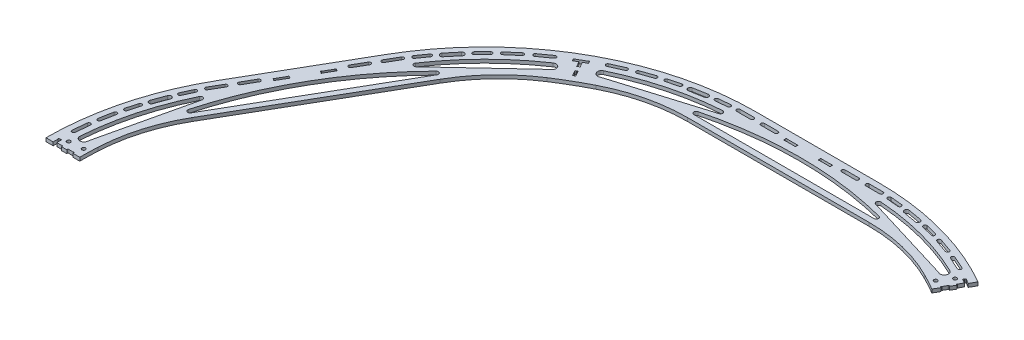
from build123d import *

# Parameters (mm, degrees)
SKETCH_1_R                       = 327.5
SKETCH_1_R_2                     = 312.5
EXTRUDE_1_DEPTH                  = 3
FILLET_1_R                       = 235
CUT_EXTRUDE_5_DEPTH              = 474.39115881
CUT_EXTRUDE_6_DEPTH              = 3
PATTERN_CIRCULAR_1_COUNT         = 5
PATTERN_CIRCULAR_1_ANGLE         = 240
PATTERN_CIRCULAR_5_COUNT         = 6
SKETCH_3_W                       = 214.60661686
SKETCH_3_H                       = 5
EXTRUDE_1_2_DEPTH                = 3
FILLET_2_R                       = 2
FILLET_3_R                       = 140
PATTERN_CIRCULAR_3_COUNT         = 6
FILLET_2_OF_PATTERN_CIRCULAR_3_R = 2
FILLET_3_OF_PATTERN_CIRCULAR_3_R = 140
CUT_EXTRUDE_8_DEPTH              = 10
FILLET_4_R                       = 3.5
FILLET_5_R                       = 2
FILLET_4_OF_MIRROR_2_R           = 3.5
FILLET_5_OF_MIRROR_2_R           = 2
PATTERN_CIRCULAR_6_COUNT         = 5
PATTERN_CIRCULAR_6_ANGLE         = 240
FILLET_4_OF_PATTERN_CIRCULAR_6_R = 3.5
FILLET_5_OF_PATTERN_CIRCULAR_6_R = 2
PATTERN_CIRCULAR_7_DEPTH         = 3
FILLET_6_R                       = 150
CUT_EXTRUDE_9_DEPTH              = 10
EXTRUDE_2_DEPTH                  = 3
FILLET_7_R                       = 2
FILLET_8_R                       = 1
FILLET_9_R                       = 3
FILLET_10_R                      = 1
FILLET_11_R                      = 10
SKETCH_14_R                      = 1.55
CUT_EXTRUDE_12_DEPTH             = 474.391158952
PATTERN_CIRCULAR_8_COUNT         = 3
CUT_EXTRUDE_11_DEPTH             = 474.391158952


with BuildPart() as part:
    # 草图1 → Extrude 1 (new body)
    # profile 1 of 7: a face of its own
    with BuildSketch(Plane(origin=(0, 0, 0), x_dir=(1, 0, 0), z_dir=(0, 1, 0))):
        with BuildLine():
            Line((283.623316881, 163.75000495), (189.08221316, 327.5))
            Line((189.08221316, 327.5), (3.91e-07, 327.5))
            ThreePointArc((3.91e-07, 327.5), (163.749997694, 283.623321071), (283.623316881, 163.75000495))
        make_face()
    # profile 2 of 7: a face of its own
    with BuildSketch(Plane(origin=(0, 0, 0), x_dir=(1, 0, 0), z_dir=(0, 1, 0))):
        Circle(SKETCH_1_R)
        with Locations(Location((0, 0, 0), (0, 0, 270))):
            Circle(SKETCH_1_R_2, mode=Mode.SUBTRACT)
    # profile 3 of 7: a face of its own
    with BuildSketch(Plane(origin=(0, 0, 0), x_dir=(1, 0, 0), z_dir=(0, 1, 0))):
        with BuildLine():
            Line((378.164426319, 0), (283.623316881, 163.75000495))
            ThreePointArc((283.623316881, 163.75000495), (316.34070737, 84.763240032), (327.5, 0))
            ThreePointArc((327.5, 0), (316.340709033, -84.763233826), (283.623323306, -163.749993823))
            Line((283.623323306, -163.749993823), (378.164426319, 0))
        make_face()
    # profile 4 of 7: a face of its own
    with BuildSketch(Plane(origin=(0, 0, 0), x_dir=(1, 0, 0), z_dir=(0, 1, 0))):
        with BuildLine():
            Line((189.08221316, -327.5), (283.623323306, -163.749993823))
            ThreePointArc((283.623323306, -163.749993823), (163.750003363, -283.623317798), (6.33e-07, -327.5))
            Line((6.33e-07, -327.5), (189.08221316, -327.5))
        make_face()
    # profile 5 of 7: a face of its own
    with BuildSketch(Plane(origin=(0, 0, 0), x_dir=(1, 0, 0), z_dir=(0, 1, 0))):
        with BuildLine():
            ThreePointArc((6.33e-07, -327.5), (-163.749996617, -283.623321693), (-283.62331615, -163.750006218))
            Line((-283.62331615, -163.750006218), (-189.08221316, -327.5))
            Line((-189.08221316, -327.5), (6.33e-07, -327.5))
        make_face()
    # profile 6 of 7: a face of its own
    with BuildSketch(Plane(origin=(0, 0, 0), x_dir=(1, 0, 0), z_dir=(0, 1, 0))):
        with BuildLine():
            ThreePointArc((-283.62331615, -163.750006218), (-327.5, 2.592e-06), (-283.623313558, 163.750010707))
            Line((-283.623313558, 163.750010707), (-378.164426319, 0))
            Line((-378.164426319, 0), (-283.62331615, -163.750006218))
        make_face()
    # profile 7 of 7: a face of its own
    with BuildSketch(Plane(origin=(0, 0, 0), x_dir=(1, 0, 0), z_dir=(0, 1, 0))):
        with BuildLine():
            ThreePointArc((-283.623313558, 163.750010707), (-163.749994477, 283.623322928), (3.91e-07, 327.5))
            Line((3.91e-07, 327.5), (-189.08221316, 327.5))
            Line((-189.08221316, 327.5), (-283.623313558, 163.750010707))
        make_face()
    extrude(amount=EXTRUDE_1_DEPTH)

    # 圆角1
    fillet_1_edges = [part.edges().sort_by_distance(p)[0] for p in [
        (189.08221316, 1.5, -327.5),
        (378.164426319, 1.5, 0),
        (189.08221316, 1.5, 327.5),
        (-189.08221316, 1.5, 327.5),
        (-378.164426319, 1.5, 0),
        (-189.08221316, 1.5, -327.5),
    ]]
    fillet(fillet_1_edges, radius=FILLET_1_R)

    # 草图2 → 切除-拉伸5 (cut, through all)
    with BuildSketch(Plane(origin=(0, 3, 0), x_dir=(1, 0, 0), z_dir=(0, 1, 0))):
        with BuildLine():
            ThreePointArc((162.730125101, 291.956844598), (162.426521922, 291.723881685), (162.376571711, 291.344472162))
            ThreePointArc((162.376571711, 291.344472162), (162.609534624, 291.040868983), (162.988944147, 290.990918772))
            Line((162.988944147, 290.990918772), (165.840673326, 289.344472162))
            Line((165.840673326, 289.344472162), (163.644226717, 285.540115039))
            ThreePointArc((163.644226717, 285.540115039), (163.290673326, 284.927742603), (163.903045762, 284.574189212))
            Line((163.903045762, 284.574189212), (164.496954238, 284.231295993))
            ThreePointArc((164.496954238, 284.231295993), (165.109326674, 283.877742603), (165.462880065, 284.490115039))
            Line((165.462880065, 284.490115039), (167.659326674, 288.294472162))
            Line((167.659326674, 288.294472162), (170.511055853, 286.648025553))
            ThreePointArc((170.511055853, 286.648025553), (170.744018767, 286.344422373), (171.123428289, 286.294472162))
            ThreePointArc((171.123428289, 286.294472162), (171.427031468, 286.527435075), (171.47698168, 286.906844598))
            Line((171.47698168, 286.906844598), (171.819874899, 287.500753074))
            ThreePointArc((171.819874899, 287.500753074), (172.123478078, 287.733715988), (172.173428289, 288.11312551))
            ThreePointArc((172.173428289, 288.11312551), (171.940465376, 288.416728689), (171.561055853, 288.466678901))
            Line((171.561055853, 288.466678901), (164.038944147, 292.809572119))
            ThreePointArc((164.038944147, 292.809572119), (163.426571711, 293.16312551), (163.07301832, 292.550753074))
            Line((163.07301832, 292.550753074), (162.730125101, 291.956844598))
        make_face()
        with BuildLine():
            Line((162.096954238, 280.074374055), (161.503045762, 280.417267274))
            ThreePointArc((161.503045762, 280.417267274), (160.890673326, 280.770820665), (160.537119935, 280.158448229))
            Line((160.537119935, 280.158448229), (158.644226717, 276.879861001))
            ThreePointArc((158.644226717, 276.879861001), (158.290673326, 276.267488565), (158.903045762, 275.913935174))
            Line((158.903045762, 275.913935174), (159.496954238, 275.571041956))
            ThreePointArc((159.496954238, 275.571041956), (160.109326674, 275.217488565), (160.462880065, 275.829861001))
            Line((160.462880065, 275.829861001), (162.355773283, 279.108448229))
            ThreePointArc((162.355773283, 279.108448229), (162.709326674, 279.720820665), (162.096954238, 280.074374055))
        make_face()
    cut_extrude_5 = extrude(amount=-CUT_EXTRUDE_5_DEPTH, mode=Mode.SUBTRACT)

    # 草图2<4> → 切除-拉伸6 (cut)
    with BuildSketch(Plane(origin=(0, 3, 0), x_dir=(1, 0, 0), z_dir=(0, 1, 0))):
        Polygon((10.657106781, 320.55), (9.95, 320.55), (9.95, 319.842893219), (9.95, 319.157106781), (9.95, 318.45), (10.657106781, 318.45), (19.342893219, 318.45), (20.05, 318.45), (20.05, 319.157106781), (20.05, 319.842893219), (20.05, 320.55), (19.342893219, 320.55), align=None)
        with BuildLine():
            ThreePointArc((20.05, 320.55), (19.696446609, 320.696446609), (19.342893219, 320.55))
            Line((19.342893219, 320.55), (20.05, 320.55))
        make_face()
        with BuildLine():
            ThreePointArc((20.05, 319.842893219), (20.196446609, 320.196446609), (20.05, 320.55))
            Line((20.05, 320.55), (20.05, 319.842893219))
        make_face()
        with BuildLine():
            Line((20.05, 319.157106781), (20.05, 318.45))
            ThreePointArc((20.05, 318.45), (20.196446609, 318.803553391), (20.05, 319.157106781))
        make_face()
        with BuildLine():
            Line((20.05, 318.45), (19.342893219, 318.45))
            ThreePointArc((19.342893219, 318.45), (19.696446609, 318.303553391), (20.05, 318.45))
        make_face()
        with BuildLine():
            ThreePointArc((9.95, 319.157106781), (9.803553391, 318.803553391), (9.95, 318.45))
            Line((9.95, 318.45), (9.95, 319.157106781))
        make_face()
        with BuildLine():
            Line((10.657106781, 318.45), (9.95, 318.45))
            ThreePointArc((9.95, 318.45), (10.303553391, 318.303553391), (10.657106781, 318.45))
        make_face()
        with BuildLine():
            Line((9.95, 319.842893219), (9.95, 320.55))
            ThreePointArc((9.95, 320.55), (9.803553391, 320.196446609), (9.95, 319.842893219))
        make_face()
        with BuildLine():
            ThreePointArc((10.657106781, 320.55), (10.303553391, 320.696446609), (9.95, 320.55))
            Line((9.95, 320.55), (10.657106781, 320.55))
        make_face()
        Polygon((-19.342893219, 320.55), (-20.05, 320.55), (-20.05, 319.842893219), (-20.05, 319.157106781), (-20.05, 318.45), (-19.342893219, 318.45), (-10.657106781, 318.45), (-9.95, 318.45), (-9.95, 319.157106781), (-9.95, 319.842893219), (-9.95, 320.55), (-10.657106781, 320.55), align=None)
        with BuildLine():
            Line((-20.05, 319.842893219), (-20.05, 320.55))
            ThreePointArc((-20.05, 320.55), (-20.196446609, 320.196446609), (-20.05, 319.842893219))
        make_face()
        with BuildLine():
            ThreePointArc((-19.342893219, 320.55), (-19.696446609, 320.696446609), (-20.05, 320.55))
            Line((-20.05, 320.55), (-19.342893219, 320.55))
        make_face()
        with BuildLine():
            Line((-20.05, 318.45), (-20.05, 319.157106781))
            ThreePointArc((-20.05, 319.157106781), (-20.196446609, 318.803553391), (-20.05, 318.45))
        make_face()
        with BuildLine():
            Line((-19.342893219, 318.45), (-20.05, 318.45))
            ThreePointArc((-20.05, 318.45), (-19.696446609, 318.303553391), (-19.342893219, 318.45))
        make_face()
        with BuildLine():
            ThreePointArc((-9.95, 319.842893219), (-9.803553391, 320.196446609), (-9.95, 320.55))
            Line((-9.95, 320.55), (-9.95, 319.842893219))
        make_face()
        with BuildLine():
            ThreePointArc((-9.95, 320.55), (-10.303553391, 320.696446609), (-10.657106781, 320.55))
            Line((-10.657106781, 320.55), (-9.95, 320.55))
        make_face()
        with BuildLine():
            ThreePointArc((-9.95, 318.45), (-9.803553391, 318.803553391), (-9.95, 319.157106781))
            Line((-9.95, 319.157106781), (-9.95, 318.45))
        make_face()
        with BuildLine():
            Line((-9.95, 318.45), (-10.657106781, 318.45))
            ThreePointArc((-10.657106781, 318.45), (-10.303553391, 318.303553391), (-9.95, 318.45))
        make_face()
    cut_extrude_6 = extrude(amount=-CUT_EXTRUDE_6_DEPTH, mode=Mode.SUBTRACT)

    # 阵列(圆周)1: 切除-拉伸5 ×5 about axis
    pattern_circular_1_axis = Axis((0, 0, 0), (0, 1, 0))
    for i in range(1, PATTERN_CIRCULAR_1_COUNT):
        add(cut_extrude_5.rotate(pattern_circular_1_axis, i * PATTERN_CIRCULAR_1_ANGLE / (PATTERN_CIRCULAR_1_COUNT - 1)), mode=Mode.SUBTRACT)

    # 阵列(圆周)5: 切除-拉伸6 ×6 about axis
    pattern_circular_5_axis = Axis((0, 0, 0), (0, 1, 0))
    for i in range(1, PATTERN_CIRCULAR_5_COUNT):
        add(cut_extrude_6.rotate(pattern_circular_5_axis, i * 360 / PATTERN_CIRCULAR_5_COUNT), mode=Mode.SUBTRACT)

    # 草图3 → Extrude 1 2 (add)
    with BuildSketch(Plane(origin=(0, 3, 0), x_dir=(1, 0, 0), z_dir=(0, 1, 0))):
        with Locations((0, 296)):
            Rectangle(SKETCH_3_W, SKETCH_3_H)
    extrude_1_2 = extrude(amount=-EXTRUDE_1_2_DEPTH)

    # 圆角2
    fillet_2_edges = [part.edges().sort_by_distance(p)[0] for p in [
        (-92.487837038, 1.5, -298.5),
        (92.487837038, 1.5, -298.5),
    ]]
    fillet(fillet_2_edges, radius=FILLET_2_R)

    # 圆角3
    fillet_3_edges = [part.edges().sort_by_distance(p)[0] for p in [
        (-107.30330843, 1.5, -293.5),
        (107.30330843, 1.5, -293.5),
    ]]
    fillet(fillet_3_edges, radius=FILLET_3_R)

    # 阵列(圆周)3: Extrude 1 2 ×6 about axis
    pattern_circular_3_axis = Axis((0, 0, 0), (0, 1, 0))
    for i in range(1, PATTERN_CIRCULAR_3_COUNT):
        add(extrude_1_2.rotate(pattern_circular_3_axis, i * 360 / PATTERN_CIRCULAR_3_COUNT))

    # 圆角2 of 阵列(圆周)3
    fillet_2_of_pattern_circular_3_edges = [part.edges().sort_by_distance(p)[0] for p in [
        (-304.752501549, 1.5, -69.153183584),
        (-212.264664511, 1.5, -229.346816416),
        (-212.264664511, 1.5, 229.346816416),
        (-304.752501549, 1.5, 69.153183584),
        (92.487837038, 1.5, 298.5),
        (-92.487837038, 1.5, 298.5),
        (304.752501549, 1.5, 69.153183584),
        (212.264664511, 1.5, 229.346816416),
        (212.264664511, 1.5, -229.346816416),
        (304.752501549, 1.5, -69.153183584),
    ]]
    fillet(fillet_2_of_pattern_circular_3_edges, radius=FILLET_2_OF_PATTERN_CIRCULAR_3_R)

    # 圆角3 of 阵列(圆周)3
    fillet_3_of_pattern_circular_3_edges = [part.edges().sort_by_distance(p)[0] for p in [
        (-307.830110226, 1.5, -53.82260899),
        (-200.526801796, 1.5, -239.67739101),
        (-200.526801796, 1.5, 239.67739101),
        (-307.830110226, 1.5, 53.82260899),
        (107.30330843, 1.5, 293.5),
        (-107.30330843, 1.5, 293.5),
        (307.830110226, 1.5, 53.82260899),
        (200.526801796, 1.5, 239.67739101),
        (200.526801796, 1.5, -239.67739101),
        (307.830110226, 1.5, -53.82260899),
    ]]
    fillet(fillet_3_of_pattern_circular_3_edges, radius=FILLET_3_OF_PATTERN_CIRCULAR_3_R)

    # 草图7 → 切除-拉伸8 (cut)
    with BuildSketch(Plane.XZ):
        with BuildLine():
            Line((175.029626383, 278.218674096), (171.086610158, 272.197762343))
            ThreePointArc((171.086610158, 272.197762343), (172.755924627, 271.141366276), (174.418716459, 270.074732896))
            Line((174.418716459, 270.074732896), (245.66253954, 203.5))
            ThreePointArc((245.66253954, 203.5), (214.731447639, 245.004901543), (175.029626383, 278.218674096))
        make_face()
        with BuildLine():
            Line((264.76819272, 186.40803798), (258.76819272, 196.800342825))
            ThreePointArc((258.76819272, 196.800342825), (256.719154615, 197.349380931), (256.170116509, 195.300342825))
            Line((256.170116509, 195.300342825), (262.170116509, 184.90803798))
            ThreePointArc((262.170116509, 184.90803798), (264.219154615, 184.358999874), (264.76819272, 186.40803798))
        make_face()
        with BuildLine():
            ThreePointArc((190.839721204, 273.168590348), (192.933431066, 273.509734029), (192.592287386, 275.603443891))
            Line((192.592287386, 275.603443891), (182.852873213, 282.61370862))
            ThreePointArc((182.852873213, 282.61370862), (180.75916335, 282.27256494), (181.10030703, 280.178855077))
            Line((181.10030703, 280.178855077), (190.839721204, 273.168590348))
        make_face()
        with BuildLine():
            ThreePointArc((206.108151691, 260.461860366), (208.223669166, 260.618659005), (208.066870527, 262.73417648))
            Line((208.066870527, 262.73417648), (198.977606072, 270.569051825))
            ThreePointArc((198.977606072, 270.569051825), (196.862088597, 270.412253186), (197.018887236, 268.296735711))
            Line((197.018887236, 268.296735711), (206.108151691, 260.461860366))
        make_face()
        with BuildLine():
            ThreePointArc((218.524851069, 248.271396128), (220.646117994, 248.256341871), (220.661172251, 250.377608797))
            Line((220.661172251, 250.377608797), (213.640463353, 257.498679403))
            ThreePointArc((213.640463353, 257.498679403), (211.519196428, 257.51373366), (211.504142171, 255.392466734))
            Line((211.504142171, 255.392466734), (218.524851069, 248.271396128))
        make_face()
        with BuildLine():
            ThreePointArc((230.453086683, 232.965532251), (233.270529754, 232.716505069), (233.519556936, 235.533948141))
            Line((233.519556936, 235.533948141), (225.814309265, 244.733358901))
            ThreePointArc((225.814309265, 244.733358901), (222.996866194, 244.982386083), (222.747839012, 242.164943011))
            Line((222.747839012, 242.164943011), (230.453086683, 232.965532251))
        make_face()
        with BuildLine():
            ThreePointArc((241.512590207, 219.562279899), (243.603584351, 219.204867688), (243.960996561, 221.295861833))
            Line((243.960996561, 221.295861833), (238.182390115, 229.457216348))
            ThreePointArc((238.182390115, 229.457216348), (236.09139597, 229.814628559), (235.73398376, 227.723634415))
            Line((235.73398376, 227.723634415), (241.512590207, 219.562279899))
        make_face()
        with BuildLine():
            ThreePointArc((248.26819272, 214.986876305), (246.219154615, 215.53591441), (245.670116509, 213.486876305))
            Line((245.670116509, 213.486876305), (251.670116509, 203.094571459))
            ThreePointArc((251.670116509, 203.094571459), (253.719154615, 202.545533354), (254.26819272, 204.594571459))
            Line((254.26819272, 204.594571459), (248.26819272, 214.986876305))
        make_face()
    cut_extrude_8 = extrude(amount=-CUT_EXTRUDE_8_DEPTH, mode=Mode.SUBTRACT)

    # 圆角4
    fillet_4_edges = [part.edges().sort_by_distance(p)[0] for p in [
        (171.086610158, 1.5, 272.197762343),
        (175.029626383, 1.5, 278.218674096),
    ]]
    fillet(fillet_4_edges, radius=FILLET_4_R)

    # 圆角5
    fillet_5_edges = [part.edges().sort_by_distance(p)[0] for p in [
        (245.66253954, 1.5, 203.5),
    ]]
    fillet(fillet_5_edges, radius=FILLET_5_R)

    # 镜向2: 切除-拉伸8 across plane
    add(cut_extrude_8.mirror(Plane(origin=(0, 0, 0), x_dir=(0.5000000000000141, 0, 0.8660254037844304), z_dir=(0.8660254037844306, 0, -0.5000000000000141))), mode=Mode.SUBTRACT)

    # 圆角4 of 镜向2
    fillet_4_of_mirror_2_edges = [part.edges().sort_by_distance(p)[0] for p in [
        (150.186871963, 1.5, 284.264231816),
        (153.429626383, 1.5, 290.68943991),
    ]]
    fillet(fillet_4_of_mirror_2_edges, radius=FILLET_4_OF_MIRROR_2_R)

    # 圆角5 of 镜向2
    fillet_5_of_mirror_2_edges = [part.edges().sort_by_distance(p)[0] for p in [
        (53.4048999, 1.5, 314.5),
    ]]
    fillet(fillet_5_of_mirror_2_edges, radius=FILLET_5_OF_MIRROR_2_R)

    # 阵列(圆周)6: 切除-拉伸8 ×5 about axis
    pattern_circular_6_axis = Axis((0, 0, 0), (0, -1, 0))
    for i in range(1, PATTERN_CIRCULAR_6_COUNT):
        add(cut_extrude_8.rotate(pattern_circular_6_axis, i * PATTERN_CIRCULAR_6_ANGLE / (PATTERN_CIRCULAR_6_COUNT - 1)), mode=Mode.SUBTRACT)

    # 圆角4 of 阵列(圆周)6
    fillet_4_of_pattern_circular_6_edges = [part.edges().sort_by_distance(p)[0] for p in [
        (-150.186871963, 1.5, 284.264231816),
        (-153.429626383, 1.5, 290.68943991),
        (-321.273482121, 1.5, 12.066469473),
        (-328.459252766, 1.5, 12.470765814),
        (-171.086610158, 1.5, -272.197762343),
        (-175.029626383, 1.5, -278.218674096),
        (150.186871963, 1.5, -284.264231816),
        (153.429626383, 1.5, -290.68943991),
    ]]
    fillet(fillet_4_of_pattern_circular_6_edges, radius=FILLET_4_OF_PATTERN_CIRCULAR_6_R)

    # 圆角5 of 阵列(圆周)6
    fillet_5_of_pattern_circular_6_edges = [part.edges().sort_by_distance(p)[0] for p in [
        (-53.4048999, 1.5, 314.5),
        (-299.06743944, 1.5, 111),
        (-245.66253954, 1.5, -203.5),
        (53.4048999, 1.5, -314.5),
    ]]
    fillet(fillet_5_of_pattern_circular_6_edges, radius=FILLET_5_OF_PATTERN_CIRCULAR_6_R)

    # 阵列(圆周)7: read off the stored shape, not the designer's step
    # 阵列(圆周)7 outline → 阵列(圆周)7 (cut)
    with BuildSketch(Plane(origin=(0, 0, 0), x_dir=(1, 0, 0), z_dir=(0, 1, 0))):
        with BuildLine():
            ThreePointArc((173.029525119, 275.164557014), (172.534006986, 272.519352771), (174.062595071, 270.304389526))
            ThreePointArc((174.062595071, 270.304389526), (174.240693602, 270.189619884), (174.418716459, 270.074732896))
            Line((174.418716459, 270.074732896), (234.541476653, 213.892224325))
            ThreePointArc((234.541476653, 213.892224325), (237.204395136, 213.8314224), (237.566105281, 216.470361106))
            ThreePointArc((237.566105281, 216.470361106), (210.644220788, 249.215653228), (177.988920442, 276.246623985))
            ThreePointArc((177.988920442, 276.246623985), (175.337698979, 276.78161955), (173.096760841, 275.2672247))
            Line((173.096760841, 275.2672247), (173.029525119, 275.164557014))
        make_face()
        with BuildLine():
            ThreePointArc((-151.784734036, 287.430242865), (-149.74167903, 285.678509452), (-147.059170549, 285.894823943))
            ThreePointArc((-147.059170549, 285.894823943), (-146.870727857, 285.991676975), (-146.682221378, 286.088405797))
            Line((-146.682221378, 286.088405797), (-67.965361611, 310.064989185))
            ThreePointArc((-67.965361611, 310.064989185), (-66.581246358, 312.340743277), (-68.685779244, 313.973462804))
            ThreePointArc((-68.685779244, 313.973462804), (-110.504976322, 307.031072977), (-150.242133859, 292.266238687))
            ThreePointArc((-150.242133859, 292.266238687), (-152.031064342, 290.237711332), (-151.840028998, 287.539804551))
            Line((-151.840028998, 287.539804551), (-151.784734036, 287.430242865))
        make_face()
        with BuildLine():
            ThreePointArc((-324.814259155, 12.265685851), (-322.275686016, 13.159156681), (-321.12176562, 15.590434417))
            ThreePointArc((-321.12176562, 15.590434417), (-321.111421459, 15.80205709), (-321.100937838, 16.013672901))
            Line((-321.100937838, 16.013672901), (-302.506838264, 96.17276486))
            ThreePointArc((-302.506838264, 96.17276486), (-303.785641494, 98.509320877), (-306.251884525, 97.503101698))
            ThreePointArc((-306.251884525, 97.503101698), (-321.14919711, 57.815419749), (-328.231054301, 16.019614702))
            ThreePointArc((-328.231054301, 16.019614702), (-327.368763321, 13.456091782), (-324.93678984, 12.272579852))
            Line((-324.93678984, 12.272579852), (-324.814259155, 12.265685851))
        make_face()
        with BuildLine():
            ThreePointArc((-173.029525119, -275.164557014), (-172.534006986, -272.519352771), (-174.062595071, -270.304389526))
            ThreePointArc((-174.062595071, -270.304389526), (-174.240693602, -270.189619884), (-174.418716459, -270.074732896))
            Line((-174.418716459, -270.074732896), (-234.541476653, -213.892224325))
            ThreePointArc((-234.541476653, -213.892224325), (-237.204395136, -213.8314224), (-237.566105281, -216.470361106))
            ThreePointArc((-237.566105281, -216.470361106), (-210.644220788, -249.215653228), (-177.988920442, -276.246623985))
            ThreePointArc((-177.988920442, -276.246623985), (-175.337698979, -276.78161955), (-173.096760841, -275.2672247))
            Line((-173.096760841, -275.2672247), (-173.029525119, -275.164557014))
        make_face()
        with BuildLine():
            Line((-307.720116509, 106.013123695), (-301.720116509, 116.405428541))
            ThreePointArc((-301.720116509, 116.405428541), (-302.269154615, 118.454466646), (-304.31819272, 117.905428541))
            Line((-304.31819272, 117.905428541), (-310.31819272, 107.513123695))
            ThreePointArc((-310.31819272, 107.513123695), (-309.769154615, 105.464085589), (-307.720116509, 106.013123695))
        make_face()
        with BuildLine():
            Line((-297.220116509, 124.199657175), (-291.220116509, 134.59196202))
            ThreePointArc((-291.220116509, 134.59196202), (-291.769154614, 136.641000126), (-293.81819272, 136.09196202))
            Line((-293.81819272, 136.09196202), (-299.81819272, 125.699657175))
            ThreePointArc((-299.81819272, 125.699657175), (-299.269154615, 123.650619069), (-297.220116509, 124.199657175))
        make_face()
        with BuildLine():
            Line((-62.05, 319.5), (-50.05, 319.5))
            ThreePointArc((-50.05, 319.5), (-48.55, 321), (-50.05, 322.5))
            Line((-50.05, 322.5), (-62.05, 322.5))
            ThreePointArc((-62.05, 322.5), (-63.55, 321), (-62.05, 319.5))
        make_face()
        with BuildLine():
            Line((-41.05, 319.5), (-29.05, 319.5))
            ThreePointArc((-29.05, 319.5), (-27.55, 321), (-29.05, 322.5))
            Line((-29.05, 322.5), (-41.05, 322.5))
            ThreePointArc((-41.05, 322.5), (-42.55, 321), (-41.05, 319.5))
        make_face()
        with BuildLine():
            Line((-245.670116509, -213.486876305), (-251.670116509, -203.094571459))
            ThreePointArc((-251.670116509, -203.094571459), (-253.719154614, -202.545533354), (-254.26819272, -204.594571459))
            Line((-254.26819272, -204.594571459), (-248.26819272, -214.986876305))
            ThreePointArc((-248.26819272, -214.986876305), (-246.219154614, -215.535914411), (-245.670116509, -213.486876305))
        make_face()
        with BuildLine():
            Line((-256.170116509, -195.300342825), (-262.170116509, -184.90803798))
            ThreePointArc((-262.170116509, -184.90803798), (-264.219154615, -184.358999874), (-264.76819272, -186.40803798))
            Line((-264.76819272, -186.40803798), (-258.76819272, -196.800342825))
            ThreePointArc((-258.76819272, -196.800342825), (-256.719154614, -197.349380931), (-256.170116509, -195.300342825))
        make_face()
        with BuildLine():
            Line((245.670116509, 213.486876305), (251.670116509, 203.094571459))
            ThreePointArc((251.670116509, 203.094571459), (253.719154614, 202.545533354), (254.26819272, 204.594571459))
            Line((254.26819272, 204.594571459), (248.26819272, 214.986876305))
            ThreePointArc((248.26819272, 214.986876305), (246.219154614, 215.535914411), (245.670116509, 213.486876305))
        make_face()
        with BuildLine():
            Line((256.170116509, 195.300342825), (262.170116509, 184.90803798))
            ThreePointArc((262.170116509, 184.90803798), (264.219154615, 184.358999874), (264.76819272, 186.40803798))
            Line((264.76819272, 186.40803798), (258.76819272, 196.800342825))
            ThreePointArc((258.76819272, 196.800342825), (256.719154614, 197.349380931), (256.170116509, 195.300342825))
        make_face()
        with BuildLine():
            Line((235.73398376, 227.723634415), (241.512590207, 219.562279899))
            ThreePointArc((241.512590207, 219.562279899), (243.603584351, 219.204867688), (243.960996561, 221.295861833))
            Line((243.960996561, 221.295861833), (238.182390115, 229.457216348))
            ThreePointArc((238.182390115, 229.457216348), (236.091395971, 229.814628559), (235.73398376, 227.723634415))
        make_face()
        with BuildLine():
            Line((-79.347460565, 318.013435679), (-69.390217002, 318.937178402))
            ThreePointArc((-69.390217002, 318.937178402), (-68.035191876, 320.569326345), (-69.667339819, 321.924351471))
            Line((-69.667339819, 321.924351471), (-79.624583382, 321.000608748))
            ThreePointArc((-79.624583382, 321.000608748), (-80.979608508, 319.368460805), (-79.347460565, 318.013435679))
        make_face()
        with BuildLine():
            Line((-315.081444325, 90.289801264), (-310.902807208, 99.374898503))
            ThreePointArc((-310.902807208, 99.374898503), (-311.638776226, 101.364458657), (-313.62833638, 100.628489638))
            Line((-313.62833638, 100.628489638), (-317.806973497, 91.543392399))
            ThreePointArc((-317.806973497, 91.543392399), (-317.071004478, 89.553832246), (-315.081444325, 90.289801264))
        make_face()
        with BuildLine():
            Line((-235.73398376, -227.723634415), (-241.512590207, -219.562279899))
            ThreePointArc((-241.512590207, -219.562279899), (-243.603584351, -219.204867688), (-243.960996561, -221.295861833))
            Line((-243.960996561, -221.295861833), (-238.182390115, -229.457216349))
            ThreePointArc((-238.182390115, -229.457216349), (-236.091395971, -229.814628559), (-235.73398376, -227.723634415))
        make_face()
        with BuildLine():
            Line((211.504142171, 255.392466734), (218.524851069, 248.271396128))
            ThreePointArc((218.524851069, 248.271396128), (220.646117995, 248.256341871), (220.661172251, 250.377608797))
            Line((220.661172251, 250.377608797), (213.640463353, 257.498679403))
            ThreePointArc((213.640463353, 257.498679403), (211.519196427, 257.51373366), (211.504142171, 255.392466734))
        make_face()
        with BuildLine():
            Line((-115.424293041, 310.864193493), (-105.746910545, 313.383770447))
            ThreePointArc((-105.746910545, 313.383770447), (-104.673239714, 315.213314365), (-106.502783632, 316.286985196))
            Line((-106.502783632, 316.286985196), (-116.180166127, 313.767408242))
            ThreePointArc((-116.180166127, 313.767408242), (-117.253836959, 311.937864324), (-115.424293041, 310.864193493))
        make_face()
        with BuildLine():
            Line((-326.928435213, 55.471726759), (-324.271761614, 65.11237432))
            ThreePointArc((-324.271761614, 65.11237432), (-325.319357708, 66.956972494), (-327.163955882, 65.909376399))
            Line((-327.163955882, 65.909376399), (-329.820629481, 56.268728839))
            ThreePointArc((-329.820629481, 56.268728839), (-328.773033387, 54.424130665), (-326.928435213, 55.471726759))
        make_face()
        with BuildLine():
            Line((-211.504142171, -255.392466734), (-218.524851069, -248.271396128))
            ThreePointArc((-218.524851069, -248.271396128), (-220.646117995, -248.256341871), (-220.661172251, -250.377608797))
            Line((-220.661172251, -250.377608797), (-213.640463353, -257.498679403))
            ThreePointArc((-213.640463353, -257.498679403), (-211.519196427, -257.51373366), (-211.504142171, -255.392466734))
        make_face()
        with BuildLine():
            Line((222.747839012, 242.164943011), (230.453086683, 232.965532251))
            ThreePointArc((230.453086683, 232.965532251), (233.270529755, 232.716505069), (233.519556936, 235.533948141))
            Line((233.519556936, 235.533948141), (225.814309265, 244.733358901))
            ThreePointArc((225.814309265, 244.733358901), (222.996866193, 244.982386083), (222.747839012, 242.164943011))
        make_face()
        with BuildLine():
            Line((-98.347073047, 313.987758728), (-86.527525794, 316.060993573))
            ThreePointArc((-86.527525794, 316.060993573), (-84.903140393, 318.376457256), (-87.218604076, 320.000842658))
            Line((-87.218604076, 320.000842658), (-99.038151329, 317.927607812))
            ThreePointArc((-99.038151329, 317.927607812), (-100.662536731, 315.612144129), (-98.347073047, 313.987758728))
        make_face()
        with BuildLine():
            Line((-321.094912059, 71.822815717), (-316.980612477, 83.095461322))
            ThreePointArc((-316.980612477, 83.095461322), (-318.173670147, 85.659952187), (-320.738161012, 84.466894517))
            Line((-320.738161012, 84.466894517), (-324.852460595, 73.194248911))
            ThreePointArc((-324.852460595, 73.194248911), (-323.659402924, 70.629758047), (-321.094912059, 71.822815717))
        make_face()
        with BuildLine():
            Line((-222.747839012, -242.164943011), (-230.453086683, -232.965532251))
            ThreePointArc((-230.453086683, -232.965532251), (-233.270529755, -232.716505069), (-233.519556936, -235.533948141))
            Line((-233.519556936, -235.533948141), (-225.814309265, -244.733358901))
            ThreePointArc((-225.814309265, -244.733358901), (-222.996866193, -244.982386083), (-222.747839012, -242.164943011))
        make_face()
        with BuildLine():
            Line((197.018887236, 268.296735711), (206.108151691, 260.461860366))
            ThreePointArc((206.108151691, 260.461860366), (208.223669166, 260.618659005), (208.066870527, 262.73417648))
            Line((208.066870527, 262.73417648), (198.977606072, 270.569051825))
            ThreePointArc((198.977606072, 270.569051825), (196.862088597, 270.412253186), (197.018887236, 268.296735711))
        make_face()
        with BuildLine():
            Line((-133.84234526, 304.771729227), (-122.512511949, 308.725825474))
            ThreePointArc((-122.512511949, 308.725825474), (-121.590544816, 310.636316669), (-123.501036011, 311.558283802))
            Line((-123.501036011, 311.558283802), (-134.830869322, 307.604187555))
            ThreePointArc((-134.830869322, 307.604187555), (-135.752836455, 305.69369636), (-133.84234526, 304.771729227))
        make_face()
        with BuildLine():
            Line((-330.861232496, 36.474993516), (-328.620663639, 48.263965108))
            ThreePointArc((-328.620663639, 48.263965108), (-329.814213982, 50.017657664), (-331.567906538, 48.824107322))
            Line((-331.567906538, 48.824107322), (-333.808475394, 37.03513573))
            ThreePointArc((-333.808475394, 37.03513573), (-332.614925052, 35.281443174), (-330.861232496, 36.474993516))
        make_face()
        with BuildLine():
            Line((-197.018887236, -268.296735711), (-206.108151691, -260.461860366))
            ThreePointArc((-206.108151691, -260.461860366), (-208.223669166, -260.618659005), (-208.066870527, -262.73417648))
            Line((-208.066870527, -262.73417648), (-198.977606072, -270.569051825))
            ThreePointArc((-198.977606072, -270.569051825), (-196.862088597, -270.412253186), (-197.018887236, -268.296735711))
        make_face()
        with BuildLine():
            Line((181.10030703, 280.178855077), (190.839721204, 273.168590348))
            ThreePointArc((190.839721204, 273.168590348), (192.933431066, 273.509734029), (192.592287386, 275.603443891))
            Line((192.592287386, 275.603443891), (182.852873213, 282.61370862))
            ThreePointArc((182.852873213, 282.61370862), (180.75916335, 282.27256494), (181.10030703, 280.178855077))
        make_face()
        with BuildLine():
            Line((-152.091852585, 296.92689406), (-141.151078156, 301.856341787))
            ThreePointArc((-141.151078156, 301.856341787), (-140.399662318, 303.840119557), (-142.383440088, 304.591535395))
            Line((-142.383440088, 304.591535395), (-153.324214516, 299.662087667))
            ThreePointArc((-153.324214516, 299.662087667), (-154.075630354, 297.678309898), (-152.091852585, 296.92689406))
        make_face()
        with BuildLine():
            Line((-333.192159615, 16.748038983), (-331.990799359, 28.687751439))
            ThreePointArc((-331.990799359, 28.687751439), (-333.333093384, 30.330385528), (-334.975727473, 28.988091503))
            Line((-334.975727473, 28.988091503), (-336.177087729, 17.048379047))
            ThreePointArc((-336.177087729, 17.048379047), (-334.834793704, 15.405744958), (-333.192159615, 16.748038983))
        make_face()
        with BuildLine():
            Line((-181.10030703, -280.178855077), (-190.839721204, -273.168590348))
            ThreePointArc((-190.839721204, -273.168590348), (-192.933431066, -273.509734029), (-192.592287386, -275.603443891))
            Line((-192.592287386, -275.603443891), (-182.852873213, -282.61370862))
            ThreePointArc((-182.852873213, -282.61370862), (-180.75916335, -282.27256494), (-181.10030703, -280.178855077))
        make_face()
    extrude(amount=PATTERN_CIRCULAR_7_DEPTH, mode=Mode.SUBTRACT)

    # 圆角6
    fillet_6_edges = [part.edges().sort_by_distance(p)[0] for p in [
        (146.682221378, 1.5, -286.088405797),
        (174.418716459, 1.5, -270.074732896),
        (146.682221378, 1.5, 286.088405797),
        (174.418716459, 1.5, 270.074732896),
        (-146.682221378, 1.5, 286.088405797),
        (-174.418716459, 1.5, 270.074732896),
        (-321.100937838, 1.5, 16.013672901),
        (-321.100937838, 1.5, -16.013672901),
        (-174.418716459, 1.5, -270.074732896),
        (-146.682221378, 1.5, -286.088405797),
    ]]
    fillet(fillet_6_edges, radius=FILLET_6_R)

    # 草图8 → 切除-拉伸9 (cut)
    with BuildSketch(Plane.XZ):
        with BuildLine():
            Line((302.817848262, 118.413871392), (290.108207292, 133.85618425))
            ThreePointArc((290.108207292, 133.85618425), (310.26164492, 76.275564186), (319.103420339, 15.914054407))
            ThreePointArc((319.103420339, 15.914054407), (319.5, 0), (319.103420339, -15.914054407))
            ThreePointArc((319.103420339, -15.914054407), (310.26164492, -76.275564186), (290.108207292, -133.85618425))
            Line((290.108207292, -133.85618425), (302.817848262, -118.413871392))
            ThreePointArc((302.817848262, -118.413871392), (303.983444234, -116.462671877), (305.129617267, -114.5))
            ThreePointArc((305.129617267, -114.5), (335.8097998, 0), (305.129617267, 114.5))
            ThreePointArc((305.129617267, 114.5), (303.983444234, 116.462671877), (302.817848262, 118.413871392))
        make_face()
    extrude(amount=-CUT_EXTRUDE_9_DEPTH, mode=Mode.SUBTRACT)

    # 草图9 → Extrude 2 (add)
    with BuildSketch(Plane.XZ):
        Polygon((321.083327329, -1.221914306), (337.740007188, 20.361413023), (320.570335235, 33.611906084), (333.118886318, 49.872018411), (315.462628768, 65.029511263), (324.19651492, 80.209096569), (309.41246768, 90.163513286), (315.68331411, 100.057257179), (301.341871148, 111.171888446), (294.890265776, 116.171888446), (292.439977327, 113.010229622), (298.8915827, 108.010229622), (310.356561231, 99.12486089), (303.951020445, 89.018604783), (318.870465958, 78.9730215), (310.343235994, 64.152606806), (327.632581366, 49.310099658), (314.959851967, 32.889080038), (332.129523919, 19.638586977), (317.916672671, 1.221914306), align=None)
    extrude_2 = extrude(amount=-EXTRUDE_2_DEPTH)

    # 镜向3: Extrude 2 across plane
    add(extrude_2.mirror(Plane.XY))

    # 圆角7
    fillet_7_edges = [part.edges().sort_by_distance(p)[0] for p in [
        (335.175101459, 1.5, 17.037869533),
        (334.679619564, 1.5, 22.723231296),
        (330.927856052, 1.5, 47.032933803),
        (329.622174594, 1.5, 52.873865366),
        (322.427888379, 1.5, 77.135205177),
        (307.538957314, 1.5, 86.602769784),
        (312.283111555, 1.5, 67.52413078),
        (313.543727082, 1.5, 61.405058484),
        (317.451921469, 1.5, 36.118244087),
        (318.039703778, 1.5, 30.512240505),
        (319.48344842, 1.5, 3.252104843),
        (315.462628768, 1.5, 65.029511263),
        (320.570335235, 1.5, 33.611906084),
        (332.129523919, 1.5, 19.638586977),
        (327.632581366, 1.5, 49.310099658),
        (318.870465958, 1.5, 78.9730215),
        (322.427888379, 1.5, -77.135205177),
        (329.622174594, 1.5, -52.873865366),
        (330.927856052, 1.5, -47.032933803),
        (334.679619564, 1.5, -22.723231296),
        (320.570335235, 1.5, -33.611906084),
        (315.462628768, 1.5, -65.029511263),
        (335.175101459, 1.5, -17.037869533),
        (307.538957314, 1.5, -86.602769784),
        (312.283111555, 1.5, -67.52413078),
        (318.870465958, 1.5, -78.9730215),
        (313.543727082, 1.5, -61.405058484),
        (317.451921469, 1.5, -36.118244087),
        (327.632581366, 1.5, -49.310099658),
        (318.039703778, 1.5, -30.512240505),
        (319.48344842, 1.5, -3.252104843),
        (332.129523919, 1.5, -19.638586977),
    ]]
    fillet(fillet_7_edges, radius=FILLET_7_R)

    # 圆角8
    fillet_8_edges = [part.edges().sort_by_distance(p)[0] for p in [
        (320.30531825, 1.5, 82.82912291),
        (314.036270739, 1.5, 97.45865658),
        (310.985476872, 1.5, 103.698085287),
        (301.373196066, 1.5, 106.086977019),
        (305.92682827, 1.5, 92.135909093),
        (310.985476872, 1.5, -103.698085287),
        (314.036270739, 1.5, -97.458656579),
        (320.30531825, 1.5, -82.82912291),
        (301.373196066, 1.5, -106.086977019),
        (305.92682827, 1.5, -92.135909093),
    ]]
    fillet(fillet_8_edges, radius=FILLET_8_R)

    # 圆角9
    fillet_9_edges = [part.edges().sort_by_distance(p)[0] for p in [
        (309.41246768, 1.5, 90.163513286),
        (310.356561231, 1.5, 99.12486089),
        (322.02632537, 1.5, 0),
        (309.41246768, 1.5, -90.163513286),
        (310.356561231, 1.5, -99.12486089),
    ]]
    fillet(fillet_9_edges, radius=FILLET_9_R)

    # 圆角10
    fillet_10_edges = [part.edges().sort_by_distance(p)[0] for p in [
        (290.108207292, 1.5, -133.85618425),
        (290.108207292, 1.5, 133.85618425),
    ]]
    fillet(fillet_10_edges, radius=FILLET_10_R)

    # 圆角11
    fillet_11_edges = [part.edges().sort_by_distance(p)[0] for p in [
        (302.817848262, 1.5, 118.413871392),
        (302.817848262, 1.5, -118.413871392),
        (298.79463277, 1.5, 113.146000494),
        (298.79463277, 1.5, -113.146000494),
    ]]
    fillet(fillet_11_edges, radius=FILLET_11_R)

    # 草图14 → 切除-拉伸12 (cut, through all)
    with BuildSketch(Plane(origin=(0, 3, 0), x_dir=(1, 0, 0), z_dir=(0, 1, 0))):
        with Locations(Location((170.612177826, 281.508960385, 0), (0, 0, 270))):
            Circle(SKETCH_14_R)
        with Locations(Location((165.47820323, 270.61665554, 0), (0, 0, 270))):
            Circle(SKETCH_14_R)
        with Locations(Location((151.62179677, 278.61665554, 0), (0, 0, 90))):
            Circle(SKETCH_14_R)
        with Locations(Location((158.487822174, 288.508960385, 0), (0, 0, 90))):
            Circle(SKETCH_14_R)
    cut_extrude_12 = extrude(amount=-CUT_EXTRUDE_12_DEPTH, mode=Mode.SUBTRACT)

    # 阵列(圆周)8: 切除-拉伸12 ×3 about axis
    pattern_circular_8_axis = Axis((0, 0, 0), (0, 1, 0))
    for i in range(1, PATTERN_CIRCULAR_8_COUNT):
        add(cut_extrude_12.rotate(pattern_circular_8_axis, i * 360 / PATTERN_CIRCULAR_8_COUNT), mode=Mode.SUBTRACT)

    # 草图13 → 切除-拉伸11 (cut, through all)
    with BuildSketch(Plane.XZ):
        with BuildLine():
            Line((-350, 0), (0, 0))
            Line((0, 0), (175, 303.108891325))
            ThreePointArc((175, 303.108891325), (-175, 303.108891325), (-350, 0))
        make_face()
        with BuildLine():
            Line((175, 303.108891325), (0, 0))
            Line((0, 0), (175, -303.108891325))
            ThreePointArc((175, -303.108891325), (303.108891325, -175), (350, 0))
            ThreePointArc((350, 0), (303.108891325, 175), (175, 303.108891325))
        make_face()
    extrude(amount=-CUT_EXTRUDE_11_DEPTH, mode=Mode.SUBTRACT)


solid = part.part
